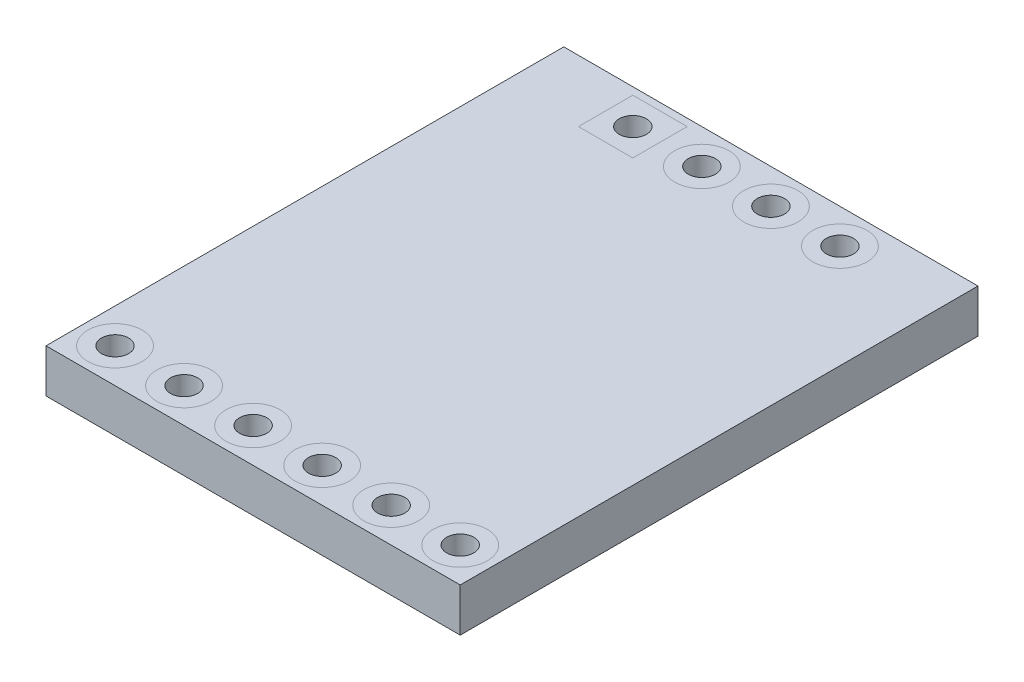
from build123d import *

# Parameters (mm, degrees)
SKETCH2_W             = 15.24
SKETCH2_H             = 19.05
SKETCH2_R             = 0.5
BOSS_EXTRUDE1_DEPTH   = 1.6
SPLIT1_OUTLINE_R      = 1
SPLIT1_OUTLINE_R_2    = 0.5
SPLIT1_DEPTH          = 1.6
SPLIT1_2_OUTLINE_R    = 1
SPLIT1_2_OUTLINE_R_2  = 0.5
SPLIT1_2_DEPTH        = 1.6
SPLIT1_3_OUTLINE_R    = 1
SPLIT1_3_OUTLINE_R_2  = 0.5
SPLIT1_3_DEPTH        = 1.6
SPLIT1_4_OUTLINE_R    = 1
SPLIT1_4_OUTLINE_R_2  = 0.5
SPLIT1_4_DEPTH        = 1.6
SPLIT1_5_OUTLINE_R    = 1
SPLIT1_5_OUTLINE_R_2  = 0.5
SPLIT1_5_DEPTH        = 1.6
SPLIT1_6_OUTLINE_R    = 1
SPLIT1_6_OUTLINE_R_2  = 0.5
SPLIT1_6_DEPTH        = 1.6
SPLIT1_7_OUTLINE_R    = 1
SPLIT1_7_OUTLINE_R_2  = 0.5
SPLIT1_7_DEPTH        = 1.6
SPLIT1_8_OUTLINE_R    = 1
SPLIT1_8_OUTLINE_R_2  = 0.5
SPLIT1_8_DEPTH        = 1.6
SPLIT1_9_OUTLINE_R    = 1
SPLIT1_9_OUTLINE_R_2  = 0.5
SPLIT1_9_DEPTH        = 1.6
SPLIT1_10_OUTLINE_W   = 2
SPLIT1_10_OUTLINE_H   = 2
SPLIT1_10_OUTLINE_R   = 0.5
SPLIT1_10_DEPTH       = 1.6
SPLIT1_11_OUTLINE_R   = 1
SPLIT1_11_OUTLINE_R_2 = 0.5
SPLIT1_11_OUTLINE_W   = 2
SPLIT1_11_OUTLINE_H   = 2
SPLIT1_11_DEPTH       = 1.6


# Read off the part's stored shape, not the designer's step: Split1
with BuildPart() as part:
    # Sketch2 → Boss-Extrude1 (new body)
    with BuildSketch(Plane(origin=(0, 0, 0), x_dir=(1, 0, 0), z_dir=(0, 1, 0))):
        Rectangle(SKETCH2_W, SKETCH2_H)
        with Locations(Location((-6.35, -8.255, 0), (0, 0, 270))):
            Circle(SKETCH2_R, mode=Mode.SUBTRACT)
        with Locations(Location((-3.81, -8.255, 0), (0, 0, 270))):
            Circle(SKETCH2_R, mode=Mode.SUBTRACT)
        with Locations(Location((-1.27, -8.255, 0), (0, 0, 270))):
            Circle(SKETCH2_R, mode=Mode.SUBTRACT)
        with Locations(Location((1.27, -8.255, 0), (0, 0, 270))):
            Circle(SKETCH2_R, mode=Mode.SUBTRACT)
        with Locations(Location((3.81, -8.255, 0), (0, 0, 270))):
            Circle(SKETCH2_R, mode=Mode.SUBTRACT)
        with Locations(Location((6.35, -8.255, 0), (0, 0, 270))):
            Circle(SKETCH2_R, mode=Mode.SUBTRACT)
        with Locations(Location((3.81, 8.255, 0), (0, 0, 90))):
            Circle(SKETCH2_R, mode=Mode.SUBTRACT)
        with Locations(Location((1.27, 8.255, 0), (0, 0, 90))):
            Circle(SKETCH2_R, mode=Mode.SUBTRACT)
        with Locations(Location((-1.27, 8.255, 0), (0, 0, 90))):
            Circle(SKETCH2_R, mode=Mode.SUBTRACT)
        with Locations(Location((-3.81, 8.255, 0), (0, 0, 90))):
            Circle(SKETCH2_R, mode=Mode.SUBTRACT)
    extrude(amount=BOSS_EXTRUDE1_DEPTH)

    # Split1 11 outline → Split1 11 (cut)
    # profile 1 of 10: a face of its own
    with BuildSketch(Plane(origin=(0, 0, 0), x_dir=(1, 0, 0), z_dir=(0, 1, 0))):
        with Locations((-6.35, -8.255)):
            Circle(SPLIT1_11_OUTLINE_R)
        with Locations((-6.35, -8.255)):
            Circle(SPLIT1_11_OUTLINE_R_2, mode=Mode.SUBTRACT)
    # profile 2 of 10: a face of its own
    with BuildSketch(Plane(origin=(0, 0, 0), x_dir=(1, 0, 0), z_dir=(0, 1, 0))):
        with Locations((-1.27, 8.255)):
            Circle(SPLIT1_11_OUTLINE_R)
        with Locations((-1.27, 8.255)):
            Circle(SPLIT1_11_OUTLINE_R_2, mode=Mode.SUBTRACT)
    # profile 3 of 10: a face of its own
    with BuildSketch(Plane(origin=(0, 0, 0), x_dir=(1, 0, 0), z_dir=(0, 1, 0))):
        with Locations((-3.81, -8.255)):
            Circle(SPLIT1_11_OUTLINE_R)
        with Locations((-3.81, -8.255)):
            Circle(SPLIT1_11_OUTLINE_R_2, mode=Mode.SUBTRACT)
    # profile 4 of 10: a face of its own
    with BuildSketch(Plane(origin=(0, 0, 0), x_dir=(1, 0, 0), z_dir=(0, 1, 0))):
        with Locations((-1.27, -8.255)):
            Circle(SPLIT1_11_OUTLINE_R)
        with Locations((-1.27, -8.255)):
            Circle(SPLIT1_11_OUTLINE_R_2, mode=Mode.SUBTRACT)
    # profile 5 of 10: a face of its own
    with BuildSketch(Plane(origin=(0, 0, 0), x_dir=(1, 0, 0), z_dir=(0, 1, 0))):
        with Locations((1.27, -8.255)):
            Circle(SPLIT1_11_OUTLINE_R)
        with Locations((1.27, -8.255)):
            Circle(SPLIT1_11_OUTLINE_R_2, mode=Mode.SUBTRACT)
    # profile 6 of 10: a face of its own
    with BuildSketch(Plane(origin=(0, 0, 0), x_dir=(1, 0, 0), z_dir=(0, 1, 0))):
        with Locations((3.81, -8.255)):
            Circle(SPLIT1_11_OUTLINE_R)
        with Locations((3.81, -8.255)):
            Circle(SPLIT1_11_OUTLINE_R_2, mode=Mode.SUBTRACT)
    # profile 7 of 10: a face of its own
    with BuildSketch(Plane(origin=(0, 0, 0), x_dir=(1, 0, 0), z_dir=(0, 1, 0))):
        with Locations((6.35, -8.255)):
            Circle(SPLIT1_11_OUTLINE_R)
        with Locations((6.35, -8.255)):
            Circle(SPLIT1_11_OUTLINE_R_2, mode=Mode.SUBTRACT)
    # profile 8 of 10: a face of its own
    with BuildSketch(Plane(origin=(0, 0, 0), x_dir=(1, 0, 0), z_dir=(0, 1, 0))):
        with Locations((1.27, 8.255)):
            Circle(SPLIT1_11_OUTLINE_R)
        with Locations((1.27, 8.255)):
            Circle(SPLIT1_11_OUTLINE_R_2, mode=Mode.SUBTRACT)
    # profile 9 of 10: a face of its own
    with BuildSketch(Plane(origin=(0, 0, 0), x_dir=(1, 0, 0), z_dir=(0, 1, 0))):
        with Locations((3.81, 8.255)):
            Circle(SPLIT1_11_OUTLINE_R)
        with Locations((3.81, 8.255)):
            Circle(SPLIT1_11_OUTLINE_R_2, mode=Mode.SUBTRACT)
    # profile 10 of 10: a face of its own
    with BuildSketch(Plane(origin=(0, 0, 0), x_dir=(1, 0, 0), z_dir=(0, 1, 0))):
        with Locations((-3.81, 8.255)):
            Rectangle(SPLIT1_11_OUTLINE_W, SPLIT1_11_OUTLINE_H)
        with Locations((-3.81, 8.255)):
            Circle(SPLIT1_11_OUTLINE_R_2, mode=Mode.SUBTRACT)
    extrude(amount=SPLIT1_11_DEPTH, mode=Mode.SUBTRACT)


with BuildPart() as body_2:
    # Split1 outline → Split1 (new body)
    with BuildSketch(Plane(origin=(0, 0, 0), x_dir=(1, 0, 0), z_dir=(0, 1, 0))):
        with Locations((-6.35, -8.255)):
            Circle(SPLIT1_OUTLINE_R)
        with Locations((-6.35, -8.255)):
            Circle(SPLIT1_OUTLINE_R_2, mode=Mode.SUBTRACT)
    extrude(amount=SPLIT1_DEPTH)


with BuildPart() as body_3:
    # Split1 2 outline → Split1 2 (new body)
    with BuildSketch(Plane(origin=(0, 0, 0), x_dir=(1, 0, 0), z_dir=(0, 1, 0))):
        with Locations((-1.27, 8.255)):
            Circle(SPLIT1_2_OUTLINE_R)
        with Locations((-1.27, 8.255)):
            Circle(SPLIT1_2_OUTLINE_R_2, mode=Mode.SUBTRACT)
    extrude(amount=SPLIT1_2_DEPTH)


with BuildPart() as body_4:
    # Split1 3 outline → Split1 3 (new body)
    with BuildSketch(Plane(origin=(0, 0, 0), x_dir=(1, 0, 0), z_dir=(0, 1, 0))):
        with Locations((-3.81, -8.255)):
            Circle(SPLIT1_3_OUTLINE_R)
        with Locations((-3.81, -8.255)):
            Circle(SPLIT1_3_OUTLINE_R_2, mode=Mode.SUBTRACT)
    extrude(amount=SPLIT1_3_DEPTH)


with BuildPart() as body_5:
    # Split1 4 outline → Split1 4 (new body)
    with BuildSketch(Plane(origin=(0, 0, 0), x_dir=(1, 0, 0), z_dir=(0, 1, 0))):
        with Locations((-1.27, -8.255)):
            Circle(SPLIT1_4_OUTLINE_R)
        with Locations((-1.27, -8.255)):
            Circle(SPLIT1_4_OUTLINE_R_2, mode=Mode.SUBTRACT)
    extrude(amount=SPLIT1_4_DEPTH)


with BuildPart() as body_6:
    # Split1 5 outline → Split1 5 (new body)
    with BuildSketch(Plane(origin=(0, 0, 0), x_dir=(1, 0, 0), z_dir=(0, 1, 0))):
        with Locations((1.27, -8.255)):
            Circle(SPLIT1_5_OUTLINE_R)
        with Locations((1.27, -8.255)):
            Circle(SPLIT1_5_OUTLINE_R_2, mode=Mode.SUBTRACT)
    extrude(amount=SPLIT1_5_DEPTH)


with BuildPart() as body_7:
    # Split1 6 outline → Split1 6 (new body)
    with BuildSketch(Plane(origin=(0, 0, 0), x_dir=(1, 0, 0), z_dir=(0, 1, 0))):
        with Locations((3.81, -8.255)):
            Circle(SPLIT1_6_OUTLINE_R)
        with Locations((3.81, -8.255)):
            Circle(SPLIT1_6_OUTLINE_R_2, mode=Mode.SUBTRACT)
    extrude(amount=SPLIT1_6_DEPTH)


with BuildPart() as body_8:
    # Split1 7 outline → Split1 7 (new body)
    with BuildSketch(Plane(origin=(0, 0, 0), x_dir=(1, 0, 0), z_dir=(0, 1, 0))):
        with Locations((6.35, -8.255)):
            Circle(SPLIT1_7_OUTLINE_R)
        with Locations((6.35, -8.255)):
            Circle(SPLIT1_7_OUTLINE_R_2, mode=Mode.SUBTRACT)
    extrude(amount=SPLIT1_7_DEPTH)


with BuildPart() as body_9:
    # Split1 8 outline → Split1 8 (new body)
    with BuildSketch(Plane(origin=(0, 0, 0), x_dir=(1, 0, 0), z_dir=(0, 1, 0))):
        with Locations((1.27, 8.255)):
            Circle(SPLIT1_8_OUTLINE_R)
        with Locations((1.27, 8.255)):
            Circle(SPLIT1_8_OUTLINE_R_2, mode=Mode.SUBTRACT)
    extrude(amount=SPLIT1_8_DEPTH)


with BuildPart() as body_10:
    # Split1 9 outline → Split1 9 (new body)
    with BuildSketch(Plane(origin=(0, 0, 0), x_dir=(1, 0, 0), z_dir=(0, 1, 0))):
        with Locations((3.81, 8.255)):
            Circle(SPLIT1_9_OUTLINE_R)
        with Locations((3.81, 8.255)):
            Circle(SPLIT1_9_OUTLINE_R_2, mode=Mode.SUBTRACT)
    extrude(amount=SPLIT1_9_DEPTH)


with BuildPart() as body_11:
    # Split1 10 outline → Split1 10 (new body)
    with BuildSketch(Plane(origin=(0, 0, 0), x_dir=(1, 0, 0), z_dir=(0, 1, 0))):
        with Locations((-3.81, 8.255)):
            Rectangle(SPLIT1_10_OUTLINE_W, SPLIT1_10_OUTLINE_H)
        with Locations((-3.81, 8.255)):
            Circle(SPLIT1_10_OUTLINE_R, mode=Mode.SUBTRACT)
    extrude(amount=SPLIT1_10_DEPTH)


solid = Compound([part.part, body_2.part, body_3.part, body_4.part, body_5.part, body_6.part, body_7.part, body_8.part, body_9.part, body_10.part, body_11.part])
